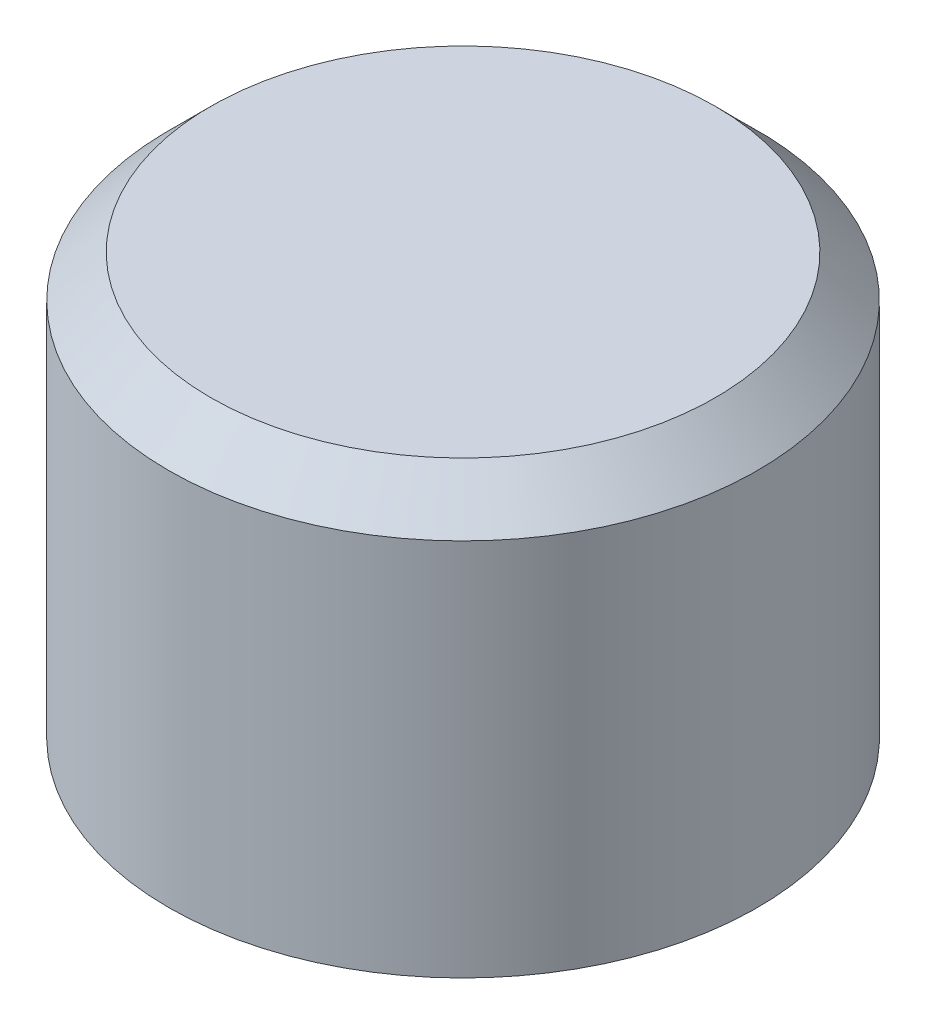
from build123d import *

# Parameters (mm, degrees)
SKETCH_1_R          = 7
EXTRUDE_1_DEPTH     = 10
CUT_EXTRUDE_1_DEPTH = 1.5
CHAMFER_1_SIZE      = 1


with BuildPart() as part:
    # 草图1 → 凸台-拉伸1 (new body)
    with BuildSketch(Plane(origin=(0, 0, 0), x_dir=(1, 0, 0), z_dir=(0, 1, 0))):
        Circle(SKETCH_1_R)
    extrude(amount=EXTRUDE_1_DEPTH)

    # 草图2 → 切除-拉伸1 (cut)
    with BuildSketch(Plane.XZ):
        with BuildLine():
            Line((-0.829156198, 1.25), (0.829156198, 1.25))
            ThreePointArc((0.829156198, 1.25), (1.5, 0), (0.829156198, -1.25))
            Line((0.829156198, -1.25), (-0.829156198, -1.25))
            ThreePointArc((-0.829156198, -1.25), (-1.5, 0), (-0.829156198, 1.25))
        make_face()
    extrude(amount=-CUT_EXTRUDE_1_DEPTH, mode=Mode.SUBTRACT)

    # 倒角1
    chamfer_1_edges = [part.edges().sort_by_distance(p)[0] for p in [
        (-7, 10, 0),
    ]]
    chamfer(chamfer_1_edges, length=CHAMFER_1_SIZE)


solid = part.part
